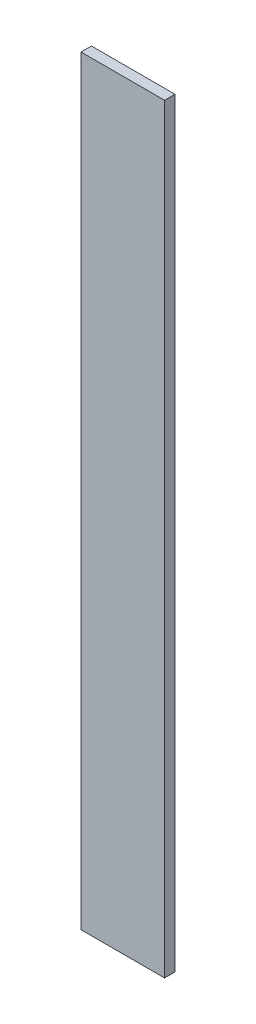
from build123d import *

# Parameters (mm, degrees)
SKETCH1_W           = 25.4
SKETCH1_H           = 3.175
BOSS_EXTRUDE1_DEPTH = 231.14


with BuildPart() as part:
    # Sketch1 → Boss-Extrude1 (new body)
    with BuildSketch(Plane(origin=(0, 0, 0), x_dir=(1, 0, 0), z_dir=(0, 1, 0))):
        Rectangle(SKETCH1_W, SKETCH1_H)
    extrude(amount=BOSS_EXTRUDE1_DEPTH)


solid = part.part
